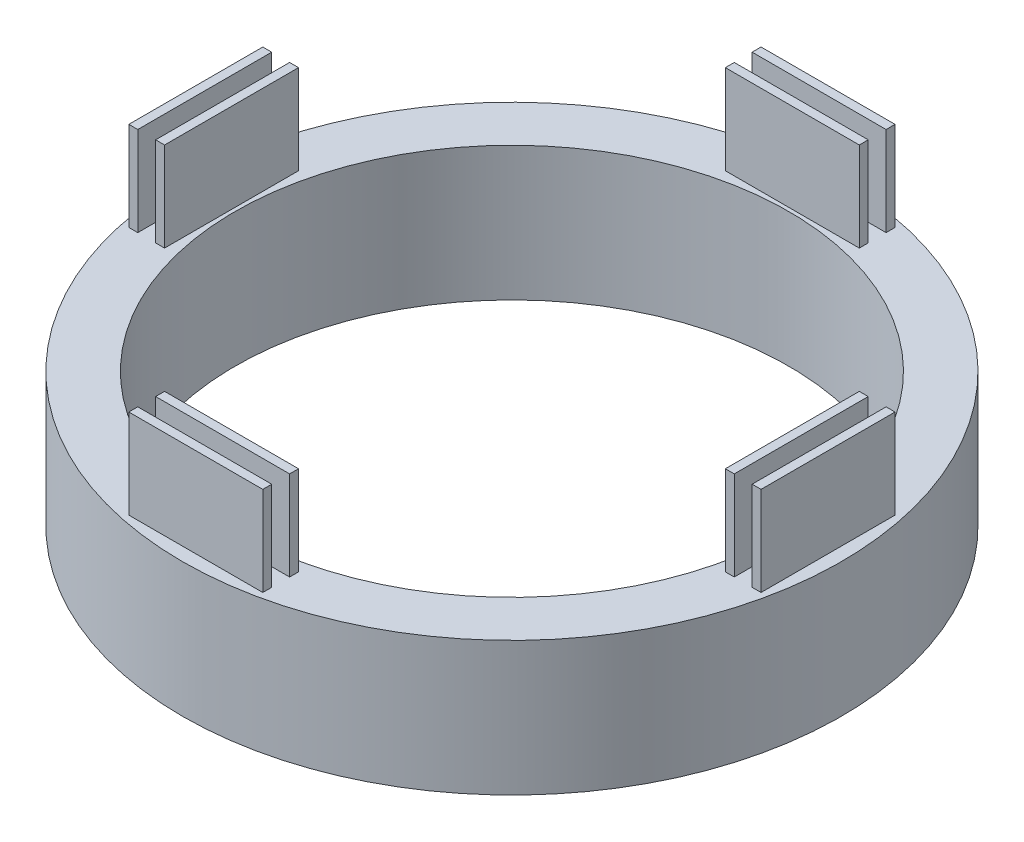
from build123d import *

# Parameters (mm, degrees)
ESQUISSE1_R        = 73.8
ESQUISSE1_R_2      = 62
BOSS_EXTRU_1_DEPTH = 30
ESQUISSE2_W        = 2
ESQUISSE2_H        = 30
ESQUISSE2_W_2      = 30
ESQUISSE2_H_2      = 2
BOSS_EXTRU_2_DEPTH = 20


with BuildPart() as part:
    # Esquisse1 → Boss.-Extru.1 (new body)
    with BuildSketch(Plane(origin=(0, 0, 0), x_dir=(1, 0, 0), z_dir=(0, 1, 0))):
        Circle(ESQUISSE1_R)
        Circle(ESQUISSE1_R_2, mode=Mode.SUBTRACT)
    extrude(amount=BOSS_EXTRU_1_DEPTH)

    # Esquisse2 → Boss.-Extru.2 (add)
    with BuildSketch(Plane(origin=(0, 30, 0), x_dir=(1, 0, 0), z_dir=(0, 1, 0))):
        with Locations((-69.786402014, 0)):
            Rectangle(ESQUISSE2_W, ESQUISSE2_H)
        with Locations((63.786402014, 0)):
            Rectangle(ESQUISSE2_W, ESQUISSE2_H)
        with Locations((-63.786402014, 0)):
            Rectangle(ESQUISSE2_W, ESQUISSE2_H)
        with Locations((69.786402014, 0)):
            Rectangle(ESQUISSE2_W, ESQUISSE2_H)
        with Locations((0, 69.786402014)):
            Rectangle(ESQUISSE2_W_2, ESQUISSE2_H_2)
        with Locations((0, 63.786402014)):
            Rectangle(ESQUISSE2_W_2, ESQUISSE2_H_2)
        with Locations((0, -69.786402014)):
            Rectangle(ESQUISSE2_W_2, ESQUISSE2_H_2)
        with Locations((0, -63.786402014)):
            Rectangle(ESQUISSE2_W_2, ESQUISSE2_H_2)
    extrude(amount=BOSS_EXTRU_2_DEPTH)


solid = part.part
